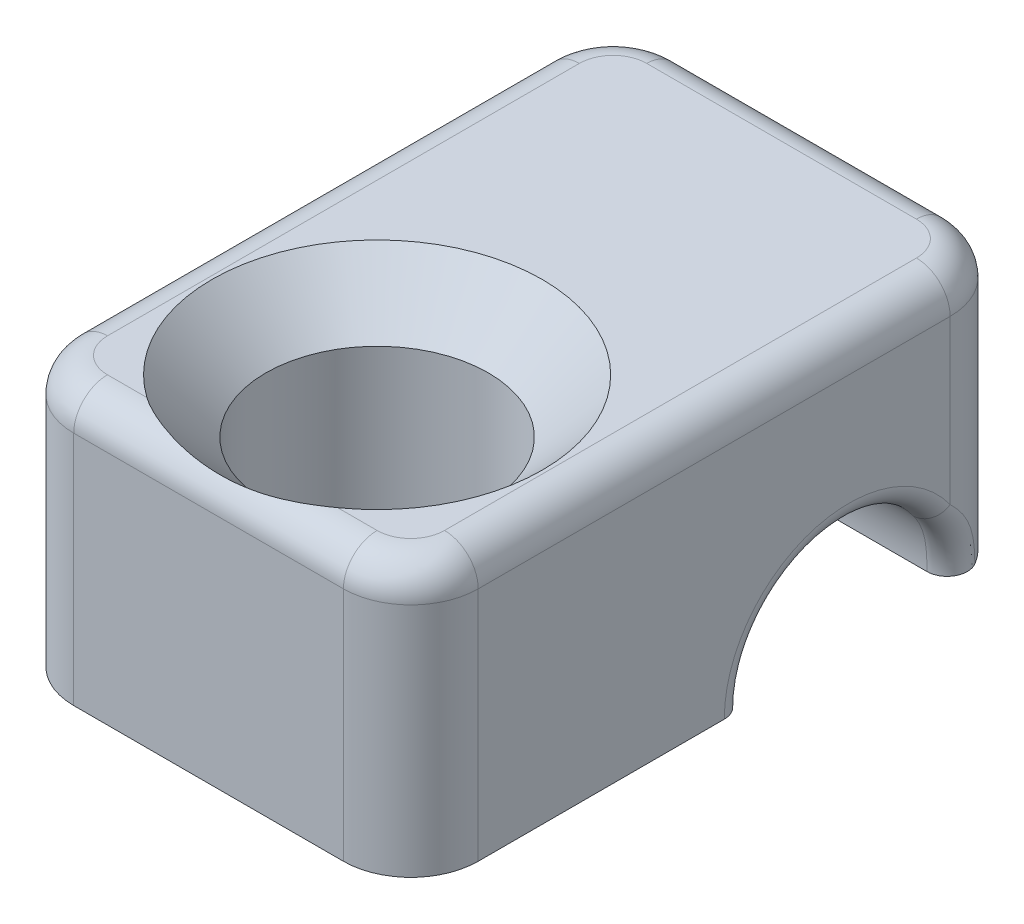
from build123d import *

# Parameters (mm, degrees)
EXTRUDE_1_DEPTH     = 6
SKETCH_2_R          = 1.65
CUT_EXTRUDE_1_DEPTH = 6
FILLET_1_R          = 1
CHAMFER_1_SIZE      = 0.8
FILLET_2_R          = 0.5
FILLET_3_R          = 0.3


with BuildPart() as part:
    # 草圖1 → 填料-伸長1 (new body)
    with BuildSketch(Plane(origin=(0, 0, 0), x_dir=(0, 0, -1), z_dir=(1, 0, 0))):
        with BuildLine():
            Line((0, 0), (4.95, 0))
            ThreePointArc((4.95, 0), (6.5, 1.55), (8.05, 0))
            Line((8.05, 0), (9, 0))
            Line((9, 0), (9, 4))
            Line((9, 4), (0, 4))
            Line((0, 4), (0, 0))
        make_face()
    extrude(amount=EXTRUDE_1_DEPTH)

    # 草圖2 → 除料-伸長1 (cut)
    with BuildSketch(Plane(origin=(0, 0, 0), x_dir=(-1, 0, 0), z_dir=(0, -1, 0))):
        with Locations(Location((-3, 2.5, 0), (0, 0, 90))):
            Circle(SKETCH_2_R)
    extrude(amount=-CUT_EXTRUDE_1_DEPTH, mode=Mode.SUBTRACT)

    # 圓角1
    fillet_1_edges = [part.edges().sort_by_distance(p)[0] for p in [
        (6, 2, -9),
        (6, 2, 0),
        (0, 2, -9),
        (0, 2, 0),
    ]]
    fillet(fillet_1_edges, radius=FILLET_1_R)

    # 導角1
    chamfer_1_edges = [part.edges().sort_by_distance(p)[0] for p in [
        (3, 4, -0.85),
    ]]
    chamfer(chamfer_1_edges, length=CHAMFER_1_SIZE)

    # 圓角2
    # the kernel refuses this fillet: 0.5 mm, written as the material it takes off along each edge
    with BuildSketch(Plane(origin=(6, 4, -8), x_dir=(-1, 0, 0), z_dir=(0, 0, 1))) as fillet_2_piece_1:
        with BuildLine():
            CenterArc((FILLET_2_R, FILLET_2_R), FILLET_2_R, 180, 90)
            Line((0, FILLET_2_R), (0, 0))
            Line((0, 0), (FILLET_2_R, 0))
        make_face()
    extrude(amount=7, mode=Mode.SUBTRACT)
    with BuildSketch(Plane(origin=(0, 4, -8), x_dir=(1, 0, 0), z_dir=(0, 0, 1))) as fillet_2_piece_2:
        with BuildLine():
            CenterArc((FILLET_2_R, -FILLET_2_R), FILLET_2_R, 90, 90)
            Line((0, -FILLET_2_R), (0, 0))
            Line((0, 0), (FILLET_2_R, 0))
        make_face()
    extrude(amount=7, mode=Mode.SUBTRACT)
    with BuildSketch(Plane(origin=(1, 4, 0), x_dir=(0, 0, -1), z_dir=(1, 0, 0))) as fillet_2_piece_3:
        with BuildLine():
            CenterArc((FILLET_2_R, -FILLET_2_R), FILLET_2_R, 90, 90)
            Line((0, -FILLET_2_R), (0, 0))
            Line((0, 0), (FILLET_2_R, 0))
        make_face()
    extrude(amount=4, mode=Mode.SUBTRACT)
    with BuildSketch(Plane(origin=(1, 4, -9), x_dir=(0, 0, 1), z_dir=(1, 0, 0))) as fillet_2_piece_4:
        with BuildLine():
            CenterArc((FILLET_2_R, FILLET_2_R), FILLET_2_R, 180, 90)
            Line((0, FILLET_2_R), (0, 0))
            Line((0, 0), (FILLET_2_R, 0))
        make_face()
    extrude(amount=4, mode=Mode.SUBTRACT)
    with BuildSketch(Plane(origin=(1, 4, -1), x_dir=(0, 0, 1), z_dir=(1, 0, 0))) as fillet_2_piece_5:
        with BuildLine():
            CenterArc((1 - FILLET_2_R, FILLET_2_R), FILLET_2_R, 270, 90)
            Line((1, FILLET_2_R), (1, 0))
            Line((1, 0), (1 - FILLET_2_R, 0))
        make_face()
    revolve(axis=Axis((1, 4, -1), (0, -1, 0)), revolution_arc=90, mode=Mode.SUBTRACT)
    with BuildSketch(Plane(origin=(5, 4, -1), x_dir=(0, 0, 1), z_dir=(-1, 0, 0))) as fillet_2_piece_6:
        with BuildLine():
            CenterArc((1 - FILLET_2_R, -FILLET_2_R), FILLET_2_R, 0, 90)
            Line((1, -FILLET_2_R), (1, 0))
            Line((1, 0), (1 - FILLET_2_R, 0))
        make_face()
    revolve(axis=Axis((5, 4, -1), (0, 1, 0)), revolution_arc=90, mode=Mode.SUBTRACT)
    with BuildSketch(Plane(origin=(1, 4, -8), x_dir=(-1, 0, 0), z_dir=(0, 0, 1))) as fillet_2_piece_7:
        with BuildLine():
            CenterArc((1 - FILLET_2_R, FILLET_2_R), FILLET_2_R, 270, 90)
            Line((1, FILLET_2_R), (1, 0))
            Line((1, 0), (1 - FILLET_2_R, 0))
        make_face()
    revolve(axis=Axis((1, 4, -8), (0, -1, 0)), revolution_arc=90, mode=Mode.SUBTRACT)
    with BuildSketch(Plane(origin=(5, 4, -8), x_dir=(1, 0, 0), z_dir=(0, 0, 1))) as fillet_2_piece_8:
        with BuildLine():
            CenterArc((1 - FILLET_2_R, -FILLET_2_R), FILLET_2_R, 0, 90)
            Line((1, -FILLET_2_R), (1, 0))
            Line((1, 0), (1 - FILLET_2_R, 0))
        make_face()
    revolve(axis=Axis((5, 4, -8), (0, 1, 0)), revolution_arc=90, mode=Mode.SUBTRACT)

    # 圓角3
    fillet_3_edges = [part.edges().sort_by_distance(p)[0] for p in [
        (6, 1.537449186, -6.303149803),
        (0.000701488, 0.196850436, -8.037449158),
        (5.999298512, 0.196850436, -8.037449158),
        (0, 1.537449186, -6.303149803),
    ]]
    fillet(fillet_3_edges, radius=FILLET_3_R)


solid = part.part
